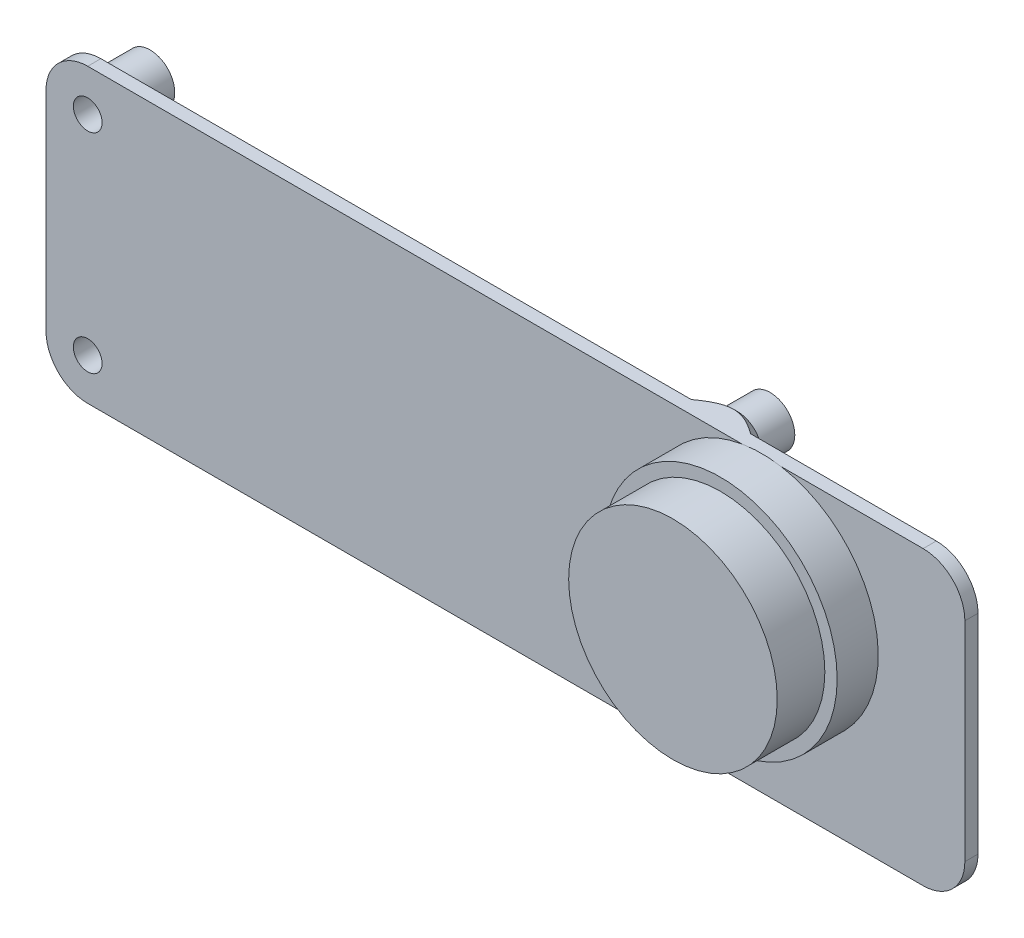
from build123d import *
from build123d.topology import SkipClean

# Parameters (mm, degrees)
SKETCH1_R           = 1.75
BOSS_EXTRUDE1_DEPTH = 1.6
SKETCH2_R           = 12.7
BOSS_EXTRUDE2_DEPTH = 10.8
BOSS_EXTRUDE3_START = 6
SKETCH3_R           = 3
SKETCH3_R_2         = 1.75
BOSS_EXTRUDE3_DEPTH = 6
SKETCH4_R           = 14.2
SKETCH4_R_2         = 12.7
BOSS_EXTRUDE4_DEPTH = 5
CHAMFER1_SIZE       = 2


with BuildPart() as part:
    # Sketch1 → Boss-Extrude1 (new body)
    with BuildSketch(Plane.XY):
        with BuildLine():
            Line((0, 5.08), (101.74, 5.08))
            ThreePointArc((101.74, 5.08), (105.332102448, 3.592102448), (106.82, 0))
            Line((106.82, 0), (106.82, -25.4))
            ThreePointArc((106.82, -25.4), (105.332102448, -28.992102448), (101.74, -30.48))
            Line((101.74, -30.48), (0, -30.48))
            ThreePointArc((0, -30.48), (-3.592102448, -28.992102448), (-5.08, -25.4))
            Line((-5.08, -25.4), (-5.08, 0))
            ThreePointArc((-5.08, 0), (-3.592102448, 3.592102448), (0, 5.08))
        make_face()
        Circle(SKETCH1_R, mode=Mode.SUBTRACT)
        with Locations((0, -25.4)):
            Circle(SKETCH1_R, mode=Mode.SUBTRACT)
        with Locations((75.51, 1.63)):
            Circle(SKETCH1_R, mode=Mode.SUBTRACT)
        with Locations((64.33, -27.48)):
            Circle(SKETCH1_R, mode=Mode.SUBTRACT)
    extrude(amount=BOSS_EXTRUDE1_DEPTH)

    # Sketch2 → Boss-Extrude2 (add)
    with BuildSketch(Plane.XY.offset(1.6)):
        with Locations(Location((82.07, -8.92, 0), (0, 0, 129.761690902))):
            Circle(SKETCH2_R)
    extrude(amount=BOSS_EXTRUDE2_DEPTH)

    # Sketch3 → Boss-Extrude3 (add)
    # profile 1 of 4: a face of its own
    with SkipClean():  # the faces are left unmerged after this step: merging them gives an invalid solid
        with BuildSketch(Plane(origin=(0, 0, 0), x_dir=(-1, 0, 0), z_dir=(0, 0, -1)).offset(BOSS_EXTRUDE3_START)):
            with Locations(Location((-75.51, 1.63, 0), (0, 0, 180))):
                Circle(SKETCH3_R)
            with Locations((-75.51, 1.63)):
                Circle(SKETCH3_R_2, mode=Mode.SUBTRACT)
        # profile 2 of 4: a face of its own
        with BuildSketch(Plane(origin=(0, 0, 0), x_dir=(-1, 0, 0), z_dir=(0, 0, -1)).offset(BOSS_EXTRUDE3_START)):
            with Locations(Location((-64.33, -27.48, 0), (0, 0, 270))):
                Circle(SKETCH3_R)
            with Locations((-64.33, -27.48)):
                Circle(SKETCH3_R_2, mode=Mode.SUBTRACT)
        # profile 3 of 4: a face of its own
        with BuildSketch(Plane(origin=(0, 0, 0), x_dir=(-1, 0, 0), z_dir=(0, 0, -1)).offset(BOSS_EXTRUDE3_START)):
            with Locations(Location((0, -25.4, 0), (0, 0, 180))):
                Circle(SKETCH3_R)
            with Locations((0, -25.4)):
                Circle(SKETCH3_R_2, mode=Mode.SUBTRACT)
        # profile 4 of 4: a face of its own
        with BuildSketch(Plane(origin=(0, 0, 0), x_dir=(-1, 0, 0), z_dir=(0, 0, -1)).offset(BOSS_EXTRUDE3_START)):
            with Locations(Location((0, 0, 0), (0, 0, 180))):
                Circle(SKETCH3_R)
            Circle(SKETCH3_R_2, mode=Mode.SUBTRACT)
        extrude(amount=-BOSS_EXTRUDE3_DEPTH)

    # Sketch4 → Boss-Extrude4 (add)
    with SkipClean():  # the faces are left unmerged after this step: merging them gives an invalid solid
        with BuildSketch(Plane.XY.offset(1.6)):
            with Locations(Location((82.07, -8.92, 0), (0, 0, 99.627632683))):
                Circle(SKETCH4_R)
            with Locations(Location((82.07, -8.92, 0), (0, 0, 180))):
                Circle(SKETCH4_R_2, mode=Mode.SUBTRACT)
        extrude(amount=BOSS_EXTRUDE4_DEPTH)

    # Chamfer1
    # the kernel refuses this chamfer: 2 mm, written as the material it adds along each edge
    with BuildSketch(Plane(origin=(75.51, 1.63, 0), x_dir=(1, 0, 0), z_dir=(0, 1, 0))) as chamfer1_piece_1_section:
        Polygon((3 + CHAMFER1_SIZE, 0), (3, CHAMFER1_SIZE), (3, 0), align=None)
    chamfer1_piece_1 = revolve(axis=Axis((75.51, 1.63, 0), (0, 0, -1)), mode=Mode.PRIVATE)
    chamfer1_piece_1 = split(chamfer1_piece_1, bisect_by=Plane(origin=(71.534469878, 5.08, -0.975530122), z_dir=(0, -1, 0)), keep=Keep.TOP, mode=Mode.PRIVATE)
    add(chamfer1_piece_1)
    with BuildSketch(Plane(origin=(64.33, -27.48, 0), x_dir=(0, -1, 0), z_dir=(1, 0, 0))) as chamfer1_piece_2_section:
        Polygon((3 + CHAMFER1_SIZE, 0), (3, CHAMFER1_SIZE), (3, 0), align=None)
    chamfer1_piece_2 = revolve(axis=Axis((64.33, -27.48, 0), (0, 0, -1)), mode=Mode.PRIVATE)
    chamfer1_piece_2 = split(chamfer1_piece_2, bisect_by=Plane(origin=(64.33, -30.48, -0.976321061), z_dir=(0, 1, 0)), keep=Keep.TOP, mode=Mode.PRIVATE)
    add(chamfer1_piece_2)
    with BuildSketch(Plane(origin=(0, -25.4, 0), x_dir=(1, 0, 0), z_dir=(0, 1, 0))) as chamfer1_piece_3:
        Polygon((3 + CHAMFER1_SIZE, 0), (3, CHAMFER1_SIZE), (3, 0), align=None)
    revolve(axis=Axis((0, -25.4, 0), (0, 0, -1)))
    with BuildSketch(Plane(origin=(0, 0, 0), x_dir=(1, 0, 0), z_dir=(0, 1, 0))) as chamfer1_piece_4:
        Polygon((3 + CHAMFER1_SIZE, 0), (3, CHAMFER1_SIZE), (3, 0), align=None)
    revolve(axis=Axis((0, 0, 0), (0, 0, -1)))


solid = part.part
